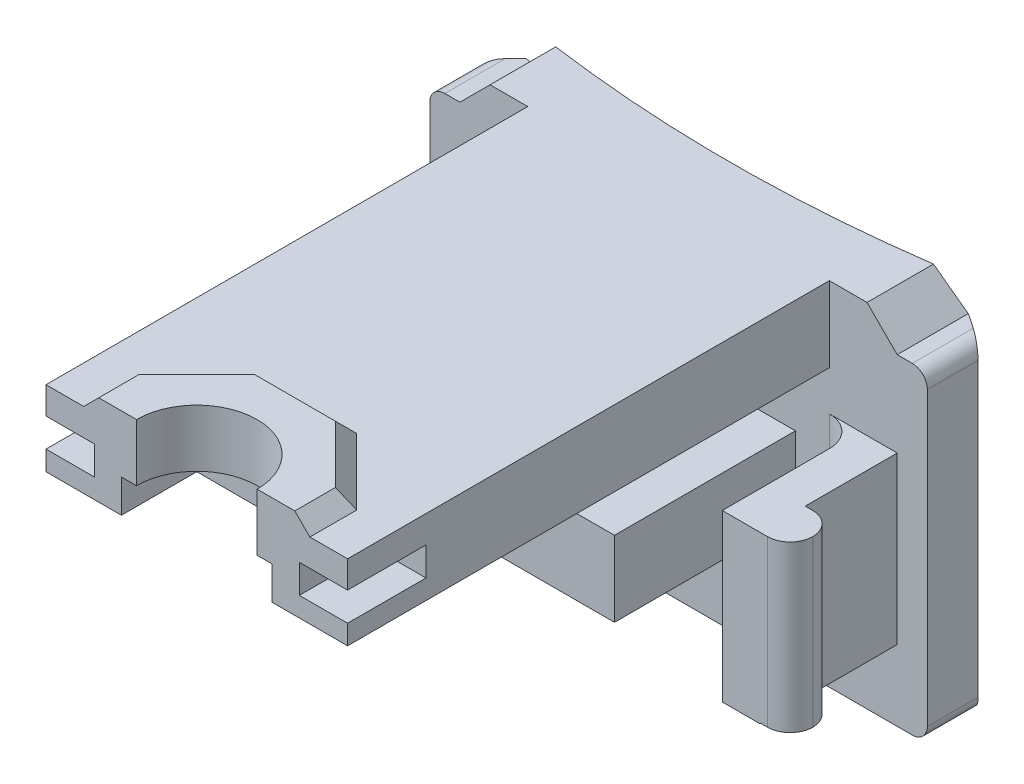
from build123d import *
from build123d.topology import SkipClean

# Parameters (mm, degrees)
BOSS_EXTRUDE1_DEPTH = 3
SKETCH2_W           = 2.5
SKETCH2_H           = 11
BOSS_EXTRUDE2_DEPTH = 9.1
SKETCH3_W           = 3
SKETCH3_H           = 10.936372413
BOSS_EXTRUDE3_DEPTH = 2
SKETCH4_W           = 3
SKETCH4_H           = 10.95
BOSS_EXTRUDE4_DEPTH = 2
FILLET2_R           = 1.5
FILLET3_R           = 2
SKETCH6_W           = 20
SKETCH6_H           = 31.95
BOSS_EXTRUDE5_DEPTH = 5
CUT_EXTRUDE1_REACH  = 47.155
BOSS_EXTRUDE6_START = 1
BOSS_EXTRUDE6_DEPTH = 1
CHAMFER1_SIZE       = 1
SKETCH10_W          = 15.5
SKETCH10_H          = 20
BOSS_EXTRUDE7_DEPTH = 1.75
BOSS_EXTRUDE8_DEPTH = 12
BOSS_EXTRUDE9_DEPTH = 23.35
CHAMFER3_SIZE       = 1.7121869
CHAMFER3_SIZE_2     = 2
FILLET4_R           = 1
CHAMFER4_SIZE       = 2
CUT_EXTRUDE2_DEPTH  = 41.997050199
CUT_EXTRUDE3_DEPTH  = 3.2
SKETCH15_W          = 5.2
SKETCH15_H          = 1.9
CUT_EXTRUDE4_DEPTH  = 3.2
SKETCH16_W          = 10
SKETCH16_H          = 5
CUT_EXTRUDE5_DEPTH  = 2.2


# Some blends are built 0.0001 mm under size
with BuildPart() as part:
    # Sketch1 → Boss-Extrude1 (new body)
    with BuildSketch(Plane.XY):
        Polygon((14.5, 12.675), (-14.5, 12.675), (-14.5, 10.675), (-16.5, 10.675), (-16.5, -10.675), (16.5, -10.675), (16.5, 10.675), (14.5, 10.675), align=None)
    extrude(amount=BOSS_EXTRUDE1_DEPTH)

    # Sketch2 → Boss-Extrude2 (add)
    with BuildSketch(Plane.XY.offset(3)):
        with Locations((13.25, -0.475)):
            Rectangle(SKETCH2_W, SKETCH2_H)
        Polygon((-14.5, 5.011372413), (-14.5, -5.975), (-12, -5.975), (-12, 5.012658035), align=None)
    extrude(amount=BOSS_EXTRUDE2_DEPTH)

    # Sketch3 → Boss-Extrude3 (add)
    with BuildSketch(Plane.ZY.offset(14.5)):
        with Locations((10.6, -0.456813794)):
            Rectangle(SKETCH3_W, SKETCH3_H)
    extrude(amount=BOSS_EXTRUDE3_DEPTH)

    # Sketch4 → Boss-Extrude4 (add)
    with BuildSketch(Plane(origin=(14.5, 0, 0), x_dir=(0, 0, -1), z_dir=(1, 0, 0))):
        with Locations((-10.6, -0.45)):
            Rectangle(SKETCH4_W, SKETCH4_H)
    extrude(amount=BOSS_EXTRUDE4_DEPTH)

    # Fillet2
    fillet2_edges = [part.edges().sort_by_distance(p)[0] for p in [
        (-16.5, -0.456813793, 9.1),
        (-16.5, -0.456813793, 12.1),
        (16.5, -0.45, 9.1),
        (16.5, -0.45, 12.1),
    ]]
    fillet(fillet2_edges, radius=FILLET2_R - 0.0001)  # a hair under: the kernel refuses the full size

    # Fillet3
    fillet3_edges = [part.edges().sort_by_distance(p)[0] for p in [
        (12, -0.475, 3),
        (-12, -0.481170983, 3),
    ]]
    fillet(fillet3_edges, radius=FILLET3_R)

    # Sketch6 → Boss-Extrude5 (add)
    with BuildSketch(Plane(origin=(0, 12.675, 0), x_dir=(1, 0, 0), z_dir=(0, 1, 0))):
        with Locations((0, -18.975)):
            Rectangle(SKETCH6_W, SKETCH6_H)
    extrude(amount=-BOSS_EXTRUDE5_DEPTH)

    # Sketch7 → Cut-Extrude1 (cut, up to next)
    with BuildSketch(Plane(origin=(0, 12.675, 0), x_dir=(1, 0, 0), z_dir=(0, 1, 0)), mode=Mode.PRIVATE) as cut_extrude1_sk1:
        with BuildLine():
            Line((-4, -34.95), (4, -34.95))
            ThreePointArc((4, -34.95), (0, -30.95), (-4, -34.95))
        make_face()
    cut_extrude1_tool1 = extrude(cut_extrude1_sk1.sketch, amount=-CUT_EXTRUDE1_REACH, mode=Mode.PRIVATE) & part.part
    add(cut_extrude1_tool1.solids().sort_by_distance((0, 12.675, 33.252347))[0], mode=Mode.SUBTRACT)

    # Sketch8 → Boss-Extrude6 (add)
    with BuildSketch(Plane(origin=(0, 12.675, 0), x_dir=(1, 0, 0), z_dir=(0, 1, 0)).offset(BOSS_EXTRUDE6_START)):
        with BuildLine():
            Line((-7.5, -34.95), (-4, -34.95))
            ThreePointArc((-4, -34.95), (0, -30.95), (4, -34.95))
            Line((4, -34.95), (7.5, -34.95))
            Line((7.5, -34.95), (7.5, -31.843398282))
            Line((7.5, -31.843398282), (3.106601718, -27.45))
            Line((3.106601718, -27.45), (-3.106601718, -27.45))
            Line((-3.106601718, -27.45), (-7.5, -31.843398282))
            Line((-7.5, -31.843398282), (-7.5, -34.95))
        make_face()
    extrude(amount=-BOSS_EXTRUDE6_DEPTH)

    # Chamfer1
    chamfer1_edges = [part.edges().sort_by_distance(p)[0] for p in [
        (-7.5, 13.675, 33.396699141),
        (-5.303300859, 13.675, 29.646699141),
        (0, 13.675, 27.45),
        (5.303300859, 13.675, 29.646699141),
        (7.5, 13.675, 33.396699141),
    ]]
    chamfer(chamfer1_edges, length=CHAMFER1_SIZE - 0.0001)  # a hair under: the kernel refuses the full size

    # Sketch10 → Boss-Extrude7 (add)
    with BuildSketch(Plane.XZ.offset(-7.675)):
        with Locations((0, 13)):
            Rectangle(SKETCH10_W, SKETCH10_H)
    extrude(amount=BOSS_EXTRUDE7_DEPTH)

    # Sketch11 → Boss-Extrude8 (add)
    with BuildSketch(Plane.XY.offset(3)):
        Polygon((-7.75, 1.425), (-7.75, -2.075), (7.75, -2.075), (7.75, 1.425), (7.75, 2.925), (-7.75, 2.925), align=None)
    extrude(amount=BOSS_EXTRUDE8_DEPTH)

    # Sketch12 → Boss-Extrude9 (add, through all)
    with BuildSketch(Plane(origin=(0, 12.675, 0), x_dir=(1, 0, 0), z_dir=(0, 1, 0))):
        with BuildLine():
            Line((-16.5, 0), (-16.5, 2))
            ThreePointArc((-16.5, 2), (0.003271262, 0.509953036), (16.5, 2.070767971))
            Line((16.5, 2.070767971), (16.5, 0))
            Line((16.5, 0), (-16.5, 0))
        make_face()
    extrude(amount=-BOSS_EXTRUDE9_DEPTH)

    # Chamfer3
    # the kernel refuses this chamfer: 2, 1.717229303, 1.7121869 mm, written as the material it takes off along each edge
    with BuildSketch(Plane(origin=(16.5, 17.877033417, -2.070767971), x_dir=(-0.98467727082698, 0, 0.1743865600232151), z_dir=(0, -1, 0))) as chamfer3_piece_1:
        with BuildLine():
            Line((2.022860888, 0), (CHAMFER3_SIZE * 0.174386559999, -CHAMFER3_SIZE * 0.984677270689))
            Line((CHAMFER3_SIZE * 0.174386559999, -CHAMFER3_SIZE * 0.984677270689), (0, 0))
            ThreePointArc((0, 0), (1.040041486, -0.005678918), (2.022860888, 0))
        make_face()
    extrude(amount=33.754066833, mode=Mode.SUBTRACT)
    with BuildSketch(Plane(origin=(-16.5, 17.818365976, -2), x_dir=(0, 0, 1), z_dir=(0, -1, 0))) as chamfer3_piece_2:
        with BuildLine():
            Line((CHAMFER3_SIZE_2, 0), (0.296949553, -1.703050447))
            ThreePointArc((0.296949553, -1.703050447), (0.156514359, -0.873485517), (0, 0))
            Line((0, 0), (CHAMFER3_SIZE_2, 0))
        make_face()
    extrude(amount=33.636731952, mode=Mode.SUBTRACT)

    # Fillet4
    fillet4_edges = [part.edges().sort_by_distance(p)[0] for p in [
        (16.5, 10.675, 1.5),
        (16.5, -10.675, 1.320709464),
        (-16.5, -10.675, 1.5),
        (-16.5, 10.675, 1.5),
    ]]
    fillet(fillet4_edges, radius=FILLET4_R)

    # Chamfer4
    chamfer4_edges = [part.edges().sort_by_distance(p)[0] for p in [
        (-14.5, 12.675, 1.5),
        (14.5, 12.675, 1.5),
    ]]
    chamfer(chamfer4_edges, length=CHAMFER4_SIZE - 0.0001)  # a hair under: the kernel refuses the full size

    # Sketch13 → Cut-Extrude2 (cut, through all)
    with SkipClean():  # the faces are left unmerged after this step: merging them gives an invalid solid
        with BuildSketch(Plane.XY):
            with BuildLine():
                Line((12.5, 12.675), (16.5, 12.675))
                Line((16.5, 12.675), (16.5, 9.675))
                ThreePointArc((16.5, 9.675), (16.207106781, 10.382106781), (15.5, 10.675))
                Line((15.5, 10.675), (14.5, 10.675))
                Line((14.5, 10.675), (12.5, 12.675))
            make_face()
            with BuildLine():
                Line((-12.5, 12.675), (-16.5, 12.675))
                Line((-16.5, 12.675), (-16.5, 9.675))
                ThreePointArc((-16.5, 9.675), (-16.207106781, 10.382106781), (-15.5, 10.675))
                Line((-15.5, 10.675), (-14.5, 10.675))
                Line((-14.5, 10.675), (-12.5, 12.675))
            make_face()
        extrude(amount=-CUT_EXTRUDE2_DEPTH, mode=Mode.SUBTRACT)

    # Sketch14 → Cut-Extrude3 (cut)
    with SkipClean():  # the faces are left unmerged after this step: merging them gives an invalid solid
        with BuildSketch(Plane(origin=(10, 0, 0), x_dir=(0, 0, -1), z_dir=(1, 0, 0))):
            Polygon((-34.95, 10.875), (-34.95, 8.975), (-29.75, 8.975), (-29.75, 9.175), (-29.75, 10.675), (-29.75, 10.875), align=None)
        extrude(amount=-CUT_EXTRUDE3_DEPTH, mode=Mode.SUBTRACT)

    # Sketch15 → Cut-Extrude4 (cut)
    with SkipClean():  # the faces are left unmerged after this step: merging them gives an invalid solid
        with BuildSketch(Plane.ZY.offset(10)):
            with Locations((32.35, 9.925)):
                Rectangle(SKETCH15_W, SKETCH15_H)
        extrude(amount=-CUT_EXTRUDE4_DEPTH, mode=Mode.SUBTRACT)

    # Sketch16 → Cut-Extrude5 (cut)
    with SkipClean():  # the faces are left unmerged after this step: merging them gives an invalid solid
        with BuildSketch(Plane.XZ.offset(-7.675)):
            with Locations((0, 32.45)):
                Rectangle(SKETCH16_W, SKETCH16_H)
        extrude(amount=-CUT_EXTRUDE5_DEPTH, mode=Mode.SUBTRACT)


solid = part.part
